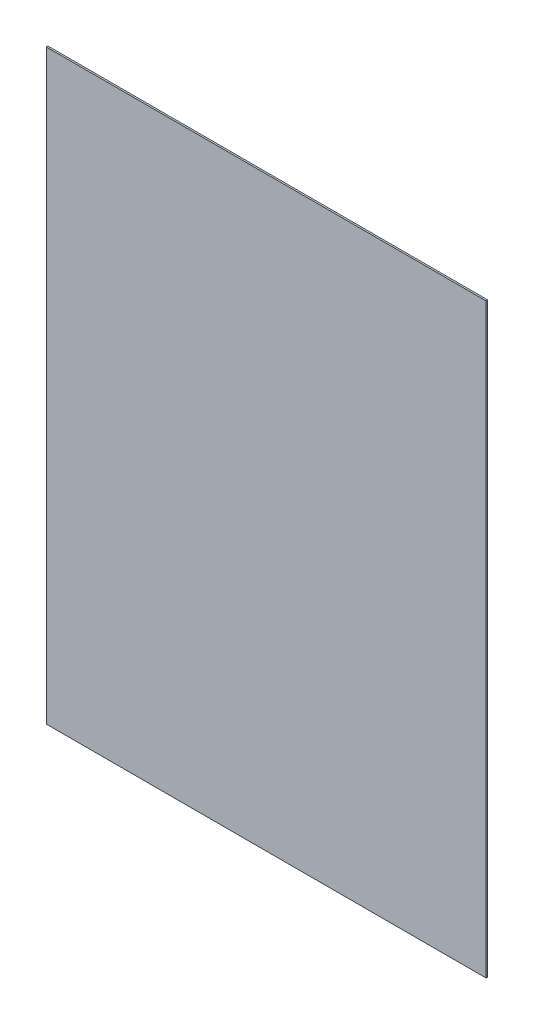
from build123d import *

# Parameters (mm, degrees)
SKETCH1_W           = 838.2
SKETCH1_H           = 1117.6
BOSS_EXTRUDE1_DEPTH = 3.175


with BuildPart() as part:
    # Sketch1 → Boss-Extrude1 (new body)
    with BuildSketch(Plane.XY):
        with Locations((419.1, 558.8)):
            Rectangle(SKETCH1_W, SKETCH1_H)
    extrude(amount=BOSS_EXTRUDE1_DEPTH)


solid = part.part
